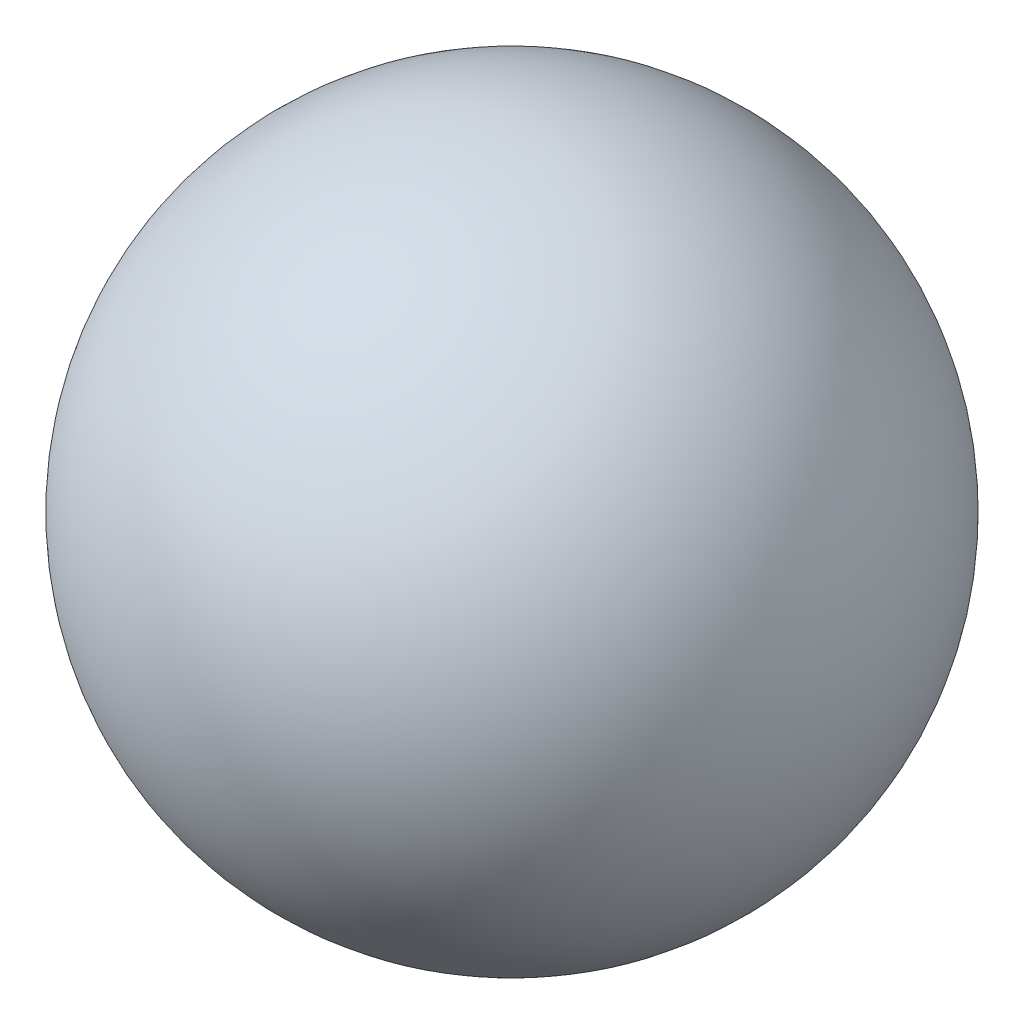
from build123d import *


with BuildPart() as part:
    # Sketch2 → Revolve2 (revolve)
    with BuildSketch(Plane.XY):
        with BuildLine():
            Line((0, 200), (0, -200))
            ThreePointArc((0, -200), (-200, 0), (0, 200))
        make_face()
    revolve(axis=Axis((0, -55, 0), (0, 1, 0)))


solid = part.part
